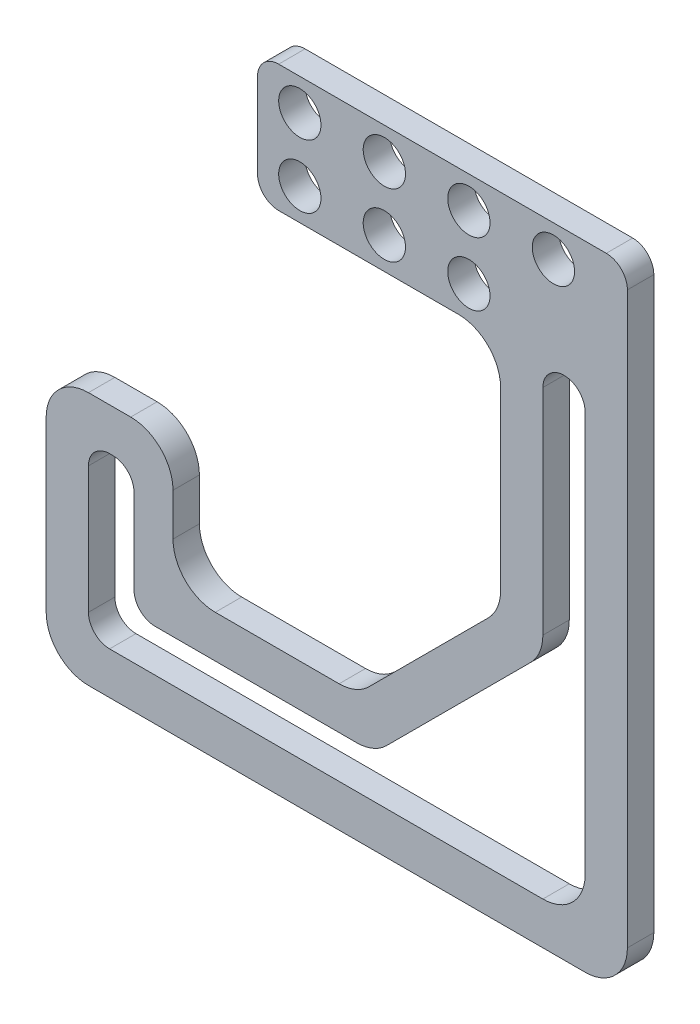
from build123d import *

# Parameters (mm, degrees)
SKETCH2_R           = 2
BOSS_EXTRUDE1_DEPTH = 2.5
FILLET1_R           = 4
FILLET2_R           = 2


with BuildPart() as part:
    # Sketch2 → Boss-Extrude1 (new body)
    with BuildSketch(Plane.XY.offset(38.1)):
        Polygon((-27.5, 0), (27.5, 0), (27.5, 59.920564885), (-7.5, 59.920564885), (-7.5, 47.920564885), (15.5, 47.920564885), (15.5, 25.623759218), (1.876240782, 12), (-15.5, 12), (-15.5, 24), (-27.5, 24), (-27.5, 12), align=None)
        with Locations((-3.5, 56.920564885)):
            Circle(SKETCH2_R, mode=Mode.SUBTRACT)
        with Locations((-3.5, 50.920564885)):
            Circle(SKETCH2_R, mode=Mode.SUBTRACT)
        with Locations((4.5, 50.920564885)):
            Circle(SKETCH2_R, mode=Mode.SUBTRACT)
        with Locations((12.5, 50.920564885)):
            Circle(SKETCH2_R, mode=Mode.SUBTRACT)
        with Locations((4.5, 56.920564885)):
            Circle(SKETCH2_R, mode=Mode.SUBTRACT)
        with Locations((12.5, 56.920564885)):
            Circle(SKETCH2_R, mode=Mode.SUBTRACT)
        with Locations((20.5, 56.920564885)):
            Circle(SKETCH2_R, mode=Mode.SUBTRACT)
        Polygon((23.5, 4), (23.5, 47.920564885), (19.5, 47.920564885), (19.5, 23.966904969), (3.533095031, 8), (-19.190748402, 8), (-19.190748402, 20), (-23.5, 20), (-23.5, 8), (-23.5, 4), align=None, mode=Mode.SUBTRACT)
    extrude(amount=BOSS_EXTRUDE1_DEPTH)

    # Fillet1
    fillet1_edges = [part.edges().sort_by_distance(p)[0] for p in [
        (15.5, 25.623759218, 39.35),
        (15.5, 47.920564885, 39.35),
        (27.5, 0, 39.35),
        (-27.5, 0, 39.35),
        (-27.5, 24, 39.35),
        (-15.5, 24, 39.35),
        (-15.5, 12, 39.35),
        (1.876240782, 12, 39.35),
        (23.5, 4, 39.35),
        (19.5, 23.966904969, 39.35),
        (3.533095031, 8, 39.35),
    ]]
    fillet(fillet1_edges, radius=FILLET1_R)

    # Fillet2
    fillet2_edges = [part.edges().sort_by_distance(p)[0] for p in [
        (-7.5, 47.920564885, 39.35),
        (-7.5, 59.920564885, 39.35),
        (27.5, 59.920564885, 39.35),
        (-23.5, 4, 39.35),
        (23.5, 47.920564885, 39.35),
        (19.5, 47.920564885, 39.35),
        (-19.190748402, 8, 39.35),
        (-19.190748402, 20, 39.35),
        (-23.5, 20, 39.35),
    ]]
    fillet(fillet2_edges, radius=FILLET2_R - 0.0001)  # a hair under: the kernel refuses the full size


solid = part.part
